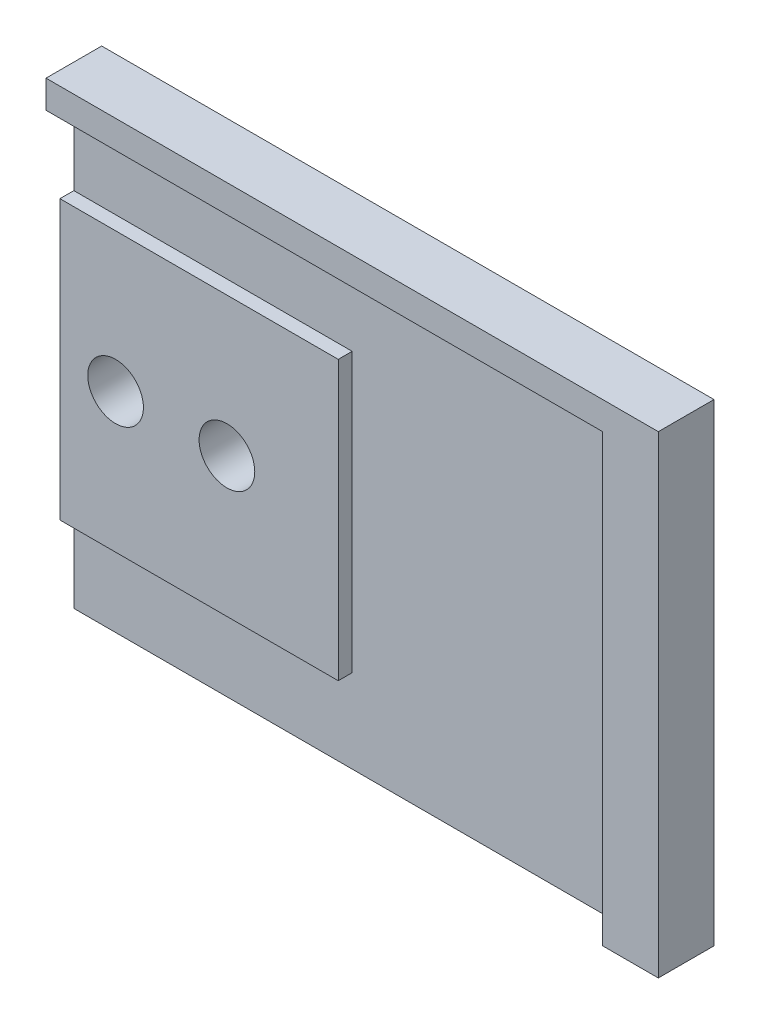
from build123d import *

# Parameters (mm, degrees)
SKIZZE1_W                       = 110
SKIZZE1_H                       = 85
AUFSATZ_LINEAR_AUSTRAGEN1_DEPTH = 10
SKIZZE2_W                       = 100
SKIZZE2_H                       = 80
SCHNITT_LINEAR_AUSTRAGEN1_DEPTH = 5
SKIZZE3_W                       = 50
SKIZZE3_H                       = 50
AUFSATZ_LINEAR_AUSTRAGEN2_DEPTH = 2.5
SKIZZE4_R                       = 5
SCHNITT_LINEAR_AUSTRAGEN2_DEPTH = 22.5


with BuildPart() as part:
    # Skizze1 → Aufsatz-Linear austragen1 (new body)
    with BuildSketch(Plane.XY):
        with Locations((8.713851874, -21.700636943)):
            Rectangle(SKIZZE1_W, SKIZZE1_H)
    extrude(amount=AUFSATZ_LINEAR_AUSTRAGEN1_DEPTH)

    # Skizze2 → Schnitt-Linear austragen1 (cut)
    with BuildSketch(Plane.XY.offset(10)):
        with Locations((3.713851874, -24.200636943)):
            Rectangle(SKIZZE2_W, SKIZZE2_H)
    extrude(amount=-SCHNITT_LINEAR_AUSTRAGEN1_DEPTH, mode=Mode.SUBTRACT)

    # Skizze3 → Aufsatz-Linear austragen2 (add)
    with BuildSketch(Plane.XY.offset(5)):
        with Locations((-21.286148126, -24.200636943)):
            Rectangle(SKIZZE3_W, SKIZZE3_H)
    extrude(amount=AUFSATZ_LINEAR_AUSTRAGEN2_DEPTH)

    # Skizze4 → Schnitt-Linear austragen2 (cut)
    with BuildSketch(Plane.XY.offset(7.5)):
        with Locations((-36.286148126, -24.200636943)):
            Circle(SKIZZE4_R)
        with Locations((-16.286148126, -24.200636943)):
            Circle(SKIZZE4_R)
    extrude(amount=-SCHNITT_LINEAR_AUSTRAGEN2_DEPTH, mode=Mode.SUBTRACT)


solid = part.part
